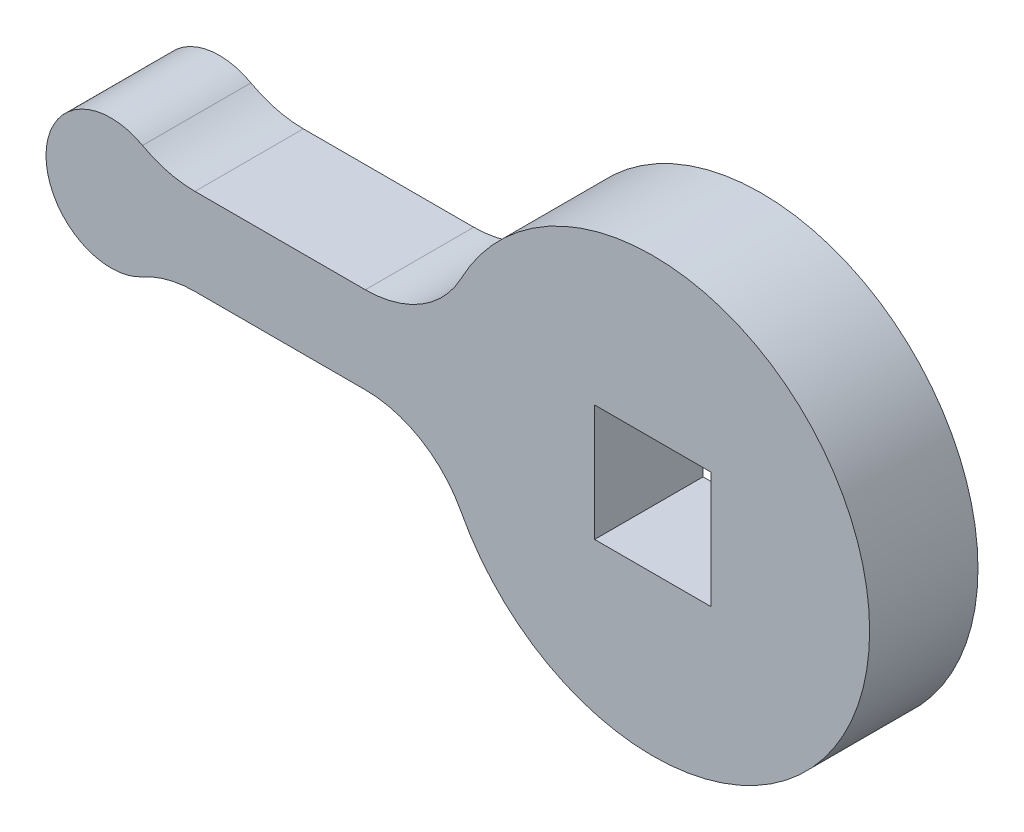
from build123d import *

# Parameters (mm, degrees)
BOSS_EXTRUDE8_DEPTH = 5
SKETCH3_3_W         = 5.374011538
SKETCH3_3_H         = 5.374011538
CUT_EXTRUDE3_DEPTH  = 31.149626863
FILLET4_R           = 5


with BuildPart() as part:
    # Sketch6 → Boss-Extrude8 (new body)
    with BuildSketch(Plane.XY):
        with BuildLine():
            Line((-22.763932023, 2), (-9.797958971, 2))
            ThreePointArc((-9.797958971, 2), (10, 0), (-9.797958971, -2))
            Line((-9.797958971, -2), (-22.763932023, -2))
            ThreePointArc((-22.763932023, -2), (-28, 0), (-22.763932023, 2))
        make_face()
    extrude(amount=BOSS_EXTRUDE8_DEPTH)

    # Sketch3<3> → Cut-Extrude3 (cut, through all)
    with BuildSketch(Plane.XY):
        Rectangle(SKETCH3_3_W, SKETCH3_3_H)
    extrude(amount=CUT_EXTRUDE3_DEPTH, mode=Mode.SUBTRACT)

    # Fillet4
    fillet4_edges = [part.edges().sort_by_distance(p)[0] for p in [
        (-22.763932023, 2, 2.5),
        (-9.797958971, -2, 2.5),
        (-22.763932023, -2, 2.5),
        (-9.797958971, 2, 2.5),
    ]]
    fillet(fillet4_edges, radius=FILLET4_R)


solid = part.part
